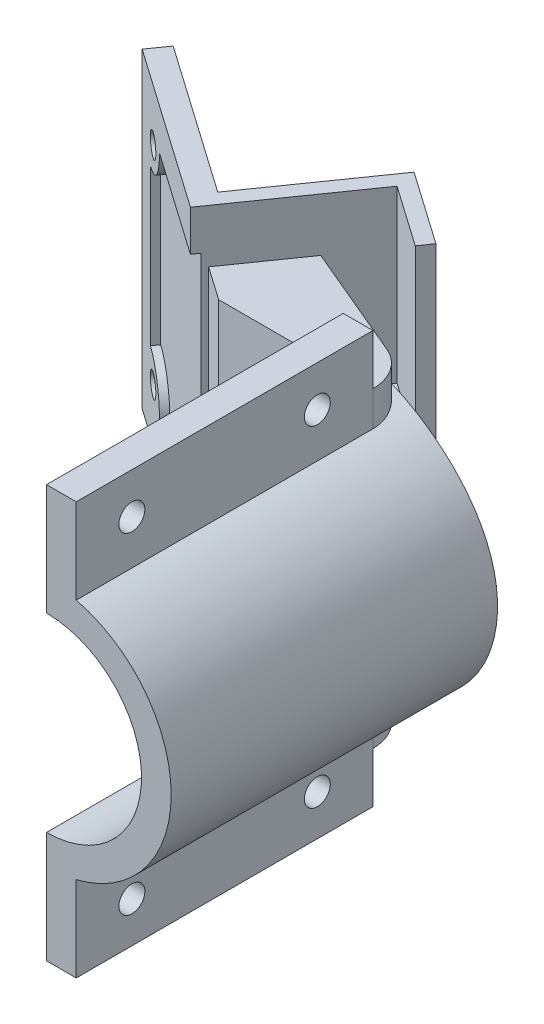
from build123d import *

# Parameters (mm, degrees)
SKETCH1_R           = 16.8
BOSS_EXTRUDE1_DEPTH = 4
BOSS_EXTRUDE2_DEPTH = 40
BOSS_EXTRUDE3_START = 4
BOSS_EXTRUDE3_DEPTH = 40
CUT_EXTRUDE1_REACH  = 58.049
SKETCH4_R           = 1.75
SKETCH6_W           = 20.8
SKETCH6_H           = 42
BOSS_EXTRUDE5_DEPTH = 4
BOSS_EXTRUDE7_REACH = 69.821
SKETCH14_R          = 1.5
CUT_EXTRUDE7_DEPTH  = 62.710359375
CUT_EXTRUDE8_START  = -3
SKETCH15_W          = 27
SKETCH15_H          = 10
SKETCH15_W_2        = 42
CUT_EXTRUDE8_DEPTH  = 59.710359375
SKETCH16_W          = 10
SKETCH16_H          = 23
CUT_EXTRUDE9_DEPTH  = 62.710359375
CUT_EXTRUDE10_DEPTH = 1
FILLET2_R           = 59
FILLET4_R           = 6
BOSS_EXTRUDE8_DEPTH = 25
BOSS_EXTRUDE9_START = -13.299219
SKETCH19_W          = 12
SKETCH19_H          = 2
BOSS_EXTRUDE9_DEPTH = 11.299219


# Read off the part's stored shape, not the designer's step: Boss-Extrude3
with BuildPart() as part:
    # Sketch1 → Boss-Extrude1 (new body)
    with BuildSketch(Plane(origin=(0, 0, 0), x_dir=(0, 1, 0), z_dir=(0, 0, 1))):
        with Locations(Location((0, 0, 0), (0, 0, 270))):
            Circle(SKETCH1_R)
    extrude(amount=BOSS_EXTRUDE1_DEPTH)

    # Sketch2 → Boss-Extrude2 (add)
    with BuildSketch(Plane.XY.offset(4)):
        with BuildLine():
            Line((0, 16.8), (0, 12.8))
            ThreePointArc((0, 12.8), (12.8, 0), (0, -12.8))
            Line((0, -12.8), (0, -16.8))
            ThreePointArc((0, -16.8), (16.8, 0), (0, 16.8))
        make_face()
    extrude(amount=BOSS_EXTRUDE2_DEPTH)

    # Boss-Extrude3 outline → Boss-Extrude3 (add)
    with BuildSketch(Plane.XY.offset(BOSS_EXTRUDE3_START)):
        with BuildLine():
            Line((0, 27.8), (0, 16.8))
            ThreePointArc((0, 16.8), (2.014536045, 16.678778268), (4, 16.316862443))
            Line((4, 16.316862443), (4, 27.8))
            Line((4, 27.8), (0, 27.8))
        make_face()
        with BuildLine():
            ThreePointArc((4, -16.316862443), (2.014536045, -16.678778268), (0, -16.8))
            Line((0, -16.8), (0, -27.8))
            Line((0, -27.8), (4, -27.8))
            Line((4, -27.8), (4, -16.316862443))
        make_face()
    extrude(amount=BOSS_EXTRUDE3_DEPTH)

    # Sketch4 → Cut-Extrude1 (cut, up to next)
    with BuildSketch(Plane.YZ.offset(4), mode=Mode.PRIVATE) as cut_extrude1_sk1:
        with Locations((22.3, 36.5)):
            Circle(SKETCH4_R)
    cut_extrude1_tool1 = extrude(cut_extrude1_sk1.sketch, amount=-CUT_EXTRUDE1_REACH, mode=Mode.PRIVATE) & part.part
    # Sketch4 → Cut-Extrude1 (cut, up to next)
    with BuildSketch(Plane.YZ.offset(4), mode=Mode.PRIVATE) as cut_extrude1_sk2:
        with Locations((22.3, 11.5)):
            Circle(SKETCH4_R)
    cut_extrude1_tool2 = extrude(cut_extrude1_sk2.sketch, amount=-CUT_EXTRUDE1_REACH, mode=Mode.PRIVATE) & part.part
    # Sketch4 → Cut-Extrude1 (cut, up to next)
    with BuildSketch(Plane.YZ.offset(4), mode=Mode.PRIVATE) as cut_extrude1_sk3:
        with Locations((-22.3, 11.5)):
            Circle(SKETCH4_R)
    cut_extrude1_tool3 = extrude(cut_extrude1_sk3.sketch, amount=-CUT_EXTRUDE1_REACH, mode=Mode.PRIVATE) & part.part
    # Sketch4 → Cut-Extrude1 (cut, up to next)
    with BuildSketch(Plane.YZ.offset(4), mode=Mode.PRIVATE) as cut_extrude1_sk4:
        with Locations((-22.3, 36.5)):
            Circle(SKETCH4_R)
    cut_extrude1_tool4 = extrude(cut_extrude1_sk4.sketch, amount=-CUT_EXTRUDE1_REACH, mode=Mode.PRIVATE) & part.part
    add(cut_extrude1_tool1.solids().sort_by_distance((4, 22.3, 36.5))[0], mode=Mode.SUBTRACT)
    add(cut_extrude1_tool2.solids().sort_by_distance((4, 22.3, 11.5))[0], mode=Mode.SUBTRACT)
    add(cut_extrude1_tool3.solids().sort_by_distance((4, -22.3, 11.5))[0], mode=Mode.SUBTRACT)
    add(cut_extrude1_tool4.solids().sort_by_distance((4, -22.3, 36.5))[0], mode=Mode.SUBTRACT)

    # Sketch6 → Boss-Extrude5 (add)
    with BuildSketch(Plane(origin=(0, 0, 0), x_dir=(1, 0, 0), z_dir=(0, 0, -1))):
        with Locations((-6.4, 0)):
            Rectangle(SKETCH6_W, SKETCH6_H)
    extrude(amount=-BOSS_EXTRUDE5_DEPTH)

    # Boss-Extrude7: up to this face of the body (flat: up to its plane)
    boss_extrude7_end = Plane(part.part.faces().sort_by_distance((-6.4, -21, 2))[0])
    # Sketch10 → Boss-Extrude7 (add, up to the picked face)
    with BuildSketch(Plane(origin=(0, 21, 0), x_dir=(-1, 0, 0), z_dir=(0, 1, 0)), mode=Mode.PRIVATE) as boss_extrude7_sk1:
        Polygon((-4, 0), (49.483656551, -22.54766646), (51.20438586, -20.090210327), (16.8, 4), (-4, 4), align=None)
    boss_extrude7_tool1 = split(extrude(boss_extrude7_sk1.sketch, amount=-BOSS_EXTRUDE7_REACH, mode=Mode.PRIVATE), bisect_by=boss_extrude7_end, keep=Keep.BOTH, mode=Mode.PRIVATE)
    add(boss_extrude7_tool1.solids().sort_by(Axis((-21.697526, 21, -6.303092), (0, -1, 0)))[0])

    # Sketch14 → Cut-Extrude7 (cut, through all)
    with BuildSketch(Plane(origin=(-7.406416038, 0, 10.577458301), x_dir=(0.8191520442889908, 0, 0.5735764363510476), z_dir=(-0.5735764363510476, 0, 0.8191520442889909))):
        with Locations((-47.467448599, 14)):
            Circle(SKETCH14_R)
        with Locations((-19.467448599, 14)):
            Circle(SKETCH14_R)
        with Locations(Location((-19.467448599, -14, 0), (0, 0, 180))):
            Circle(SKETCH14_R)
        with Locations(Location((-47.467448599, -14, 0), (0, 0, 180))):
            Circle(SKETCH14_R)
    extrude(amount=-CUT_EXTRUDE7_DEPTH, mode=Mode.SUBTRACT)

    # Sketch15 → Cut-Extrude8 (cut, through all)
    with BuildSketch(Plane(origin=(-7.406416038, 0, 10.577458301), x_dir=(0.8191520442889908, 0, 0.5735764363510476), z_dir=(-0.5735764363510476, 0, 0.8191520442889909)).offset(CUT_EXTRUDE8_START)):
        with Locations((-39.967448599, 16)):
            Rectangle(SKETCH15_W, SKETCH15_H)
        with Locations((-32.467448599, -16)):
            Rectangle(SKETCH15_W_2, SKETCH15_H)
    extrude(amount=-CUT_EXTRUDE8_DEPTH, mode=Mode.SUBTRACT)

    # Sketch16 → Cut-Extrude9 (cut, through all)
    with BuildSketch(Plane(origin=(-7.406416038, 0, 10.577458301), x_dir=(0.8191520442889908, 0, 0.5735764363510476), z_dir=(-0.5735764363510476, 0, 0.8191520442889909))):
        with Locations((-21.967448599, 9.5)):
            Rectangle(SKETCH16_W, SKETCH16_H)
    extrude(amount=-CUT_EXTRUDE9_DEPTH, mode=Mode.SUBTRACT)

    # Sketch17 → Cut-Extrude10 (cut)
    with BuildSketch(Plane(origin=(-7.406416038, 0, 10.577458301), x_dir=(0.8191520442889908, 0, 0.5735764363510476), z_dir=(-0.5735764363510476, 0, 0.8191520442889909))):
        with BuildLine():
            Line((-48.967448599, 10.5), (-48.967448599, -10.5))
            ThreePointArc((-48.967448599, -10.5), (-45.431914693, -11.964466094), (-43.967448599, -15.5))
            Line((-43.967448599, -15.5), (-22.967448599, -15.5))
            ThreePointArc((-22.967448599, -15.5), (-22.539929967, -13.477028389), (-21.330482943, -11.8))
            Line((-21.330482943, -11.8), (-17.967448599, -11.8))
            Line((-17.967448599, -11.8), (-17.967448599, 15.5))
            Line((-17.967448599, 15.5), (-43.967448599, 15.5))
            ThreePointArc((-43.967448599, 15.5), (-45.431914693, 11.964466094), (-48.967448599, 10.5))
        make_face()
    extrude(amount=-CUT_EXTRUDE10_DEPTH, mode=Mode.SUBTRACT)

    # Fillet2
    fillet2_edges = [part.edges().sort_by_distance(p)[0] for p in [
        (4, 0, 0),
    ]]
    fillet(fillet2_edges, radius=FILLET2_R)

    # Fillet4
    fillet4_edges = [part.edges().sort_by_distance(p)[0] for p in [
        (4, 18.658431222, 0),
        (4, -18.658431222, 0),
    ]]
    fillet(fillet4_edges, radius=FILLET4_R)

    # Sketch18 → Boss-Extrude8 (add)
    with BuildSketch(Plane(origin=(0, 21, 0), x_dir=(-1, 0, 0), z_dir=(0, 1, 0))):
        Polygon((28.92328025, -5.709586808), (18.025327959, -21.273475649), (9.833807517, -15.537711286), (8.686654644, -17.176015374), (18.516479175, -24.058932611), (30.561584339, -6.85673968), align=None)
    extrude(amount=-BOSS_EXTRUDE8_DEPTH)

    # Sketch19 → Boss-Extrude9 (add)
    with BuildSketch(Plane(origin=(5.212265562, 0, -7.443886673), x_dir=(0.819152044288991, 0, 0.5735764363510472), z_dir=(0.5735764363510472, 0, -0.819152044288991)).offset(BOSS_EXTRUDE9_START)):
        with Locations((-22.967448599, 3)):
            Rectangle(SKETCH19_W, SKETCH19_H)
    extrude(amount=BOSS_EXTRUDE9_DEPTH)


solid = part.part
